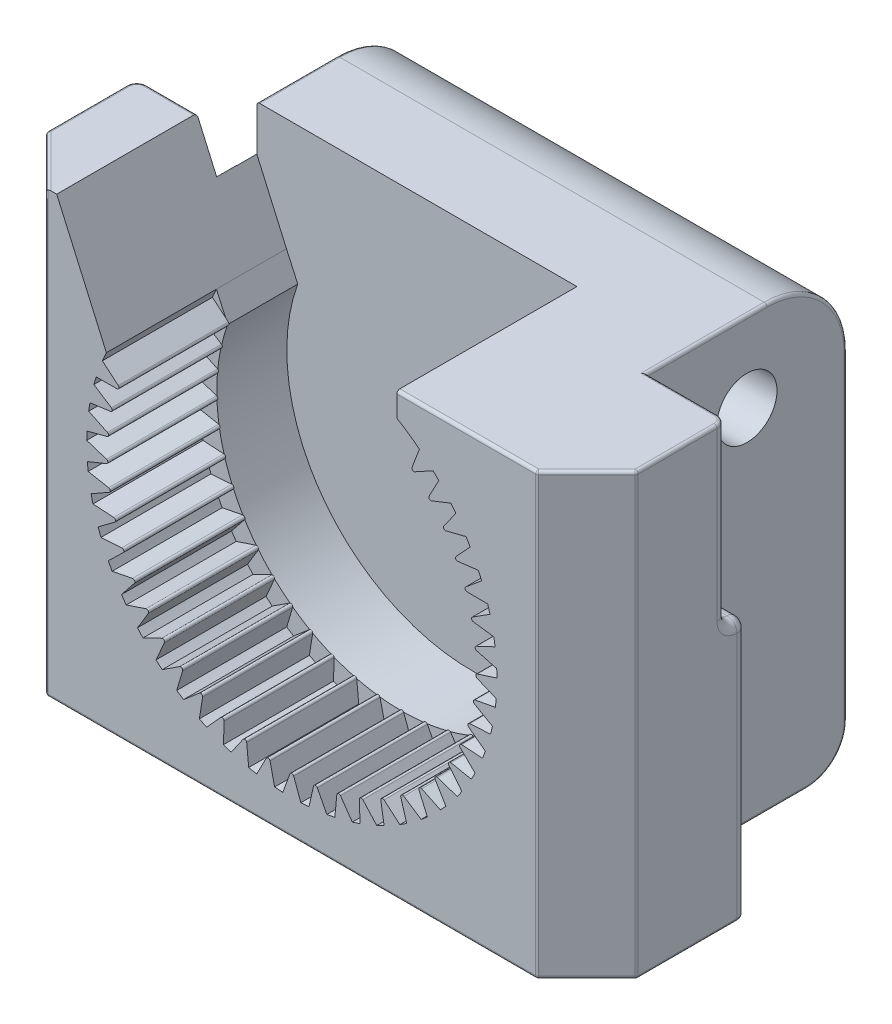
from build123d import *

# Parameters (mm, degrees)
SKETCH_1_W               = 59
SKETCH_1_H               = 44
EXTRUDE_1_DEPTH          = 34
SKETCH_2_R               = 4
CUT_EXTRUDE_1_DEPTH      = 51.102395152
CUT_EXTRUDE_2_DEPTH      = 63.946405775
CUT_EXTRUDE_3_DEPTH      = 18
CHAMFER_1_SIZE           = 5
CHAMFER_2_SIZE           = 5
FILLET_1_R               = 4
FILLET_2_R               = 8
SKETCH_6_R               = 3
CUT_EXTRUDE_4_DEPTH      = 66.122960621
CUT_EXTRUDE_5_DEPTH      = 2
FILLET_START             = -30
FILLET_3_DEPTH           = 8.5
FILLET_START_2           = 21.5
FILLET_3_2_DEPTH         = 8.5
FILLET_START_3           = -29.5
FILLET_3_3_DEPTH         = 8
FILLET_3_4_DEPTH         = 8
FILLET_4_R               = 1
FILLET_5_R               = 0.3
FILLET_6_R               = 0.3
EXTRUDE_START            = 7
EXTRUDE_2_DEPTH          = 7
EXTRUDE_3_DEPTH          = 11
PATTERN_CIRCULAR_1_COUNT = 16
PATTERN_CIRCULAR_1_ANGLE = 110
PATTERN_CIRCULAR_2_COUNT = 20
PATTERN_CIRCULAR_2_ANGLE = 139


with BuildPart() as part:
    # Эскиз1 → Бобышка-Вытянуть1 (new body)
    with BuildSketch(Plane.XY):
        Rectangle(SKETCH_1_W, SKETCH_1_H)
    extrude(amount=EXTRUDE_1_DEPTH)

    # Эскиз2 → Вырез-Вытянуть1 (cut, through all)
    with BuildSketch(Plane.XY.offset(34)):
        with Locations((0, 2)):
            Circle(SKETCH_2_R)
    extrude(amount=-CUT_EXTRUDE_1_DEPTH, mode=Mode.SUBTRACT)

    # Эскиз3 → Вырез-Вытянуть2 (cut, through all)
    with BuildSketch(Plane(origin=(0, 22, 0), x_dir=(1, 0, 0), z_dir=(0, 1, 0))):
        Polygon((-21.5, 5.182820552), (-21.5, -18), (-29.840908982, -18), (-29.840908982, 8.49465206), (29.840908982, 8.49465206), (29.840908982, -18), (21.5, -18), (21.5, 5.182820552), align=None)
    extrude(amount=-CUT_EXTRUDE_2_DEPTH, mode=Mode.SUBTRACT)

    # Эскиз4 → Вырез-Вытянуть3 (cut)
    with BuildSketch(Plane.XY.offset(34)):
        with BuildLine():
            Line((-23.5, 22), (-18.535280006, 10.757476525))
            ThreePointArc((-18.535280006, 10.757476525), (5.976548945, -17.609458501), (10.5, 19.606816862))
            Line((10.5, 19.606816862), (10.5, 22))
            Line((10.5, 22), (-23.5, 22))
        make_face()
    extrude(amount=-CUT_EXTRUDE_3_DEPTH, mode=Mode.SUBTRACT)

    # Фаска1
    chamfer_1_edges = [part.edges().sort_by_distance(p)[0] for p in [
        (-29.5, 0, 34),
    ]]
    chamfer(chamfer_1_edges, length=CHAMFER_1_SIZE)

    # Фаска2
    chamfer_2_edges = [part.edges().sort_by_distance(p)[0] for p in [
        (29.5, 0, 34),
    ]]
    chamfer(chamfer_2_edges, length=CHAMFER_2_SIZE)

    # Скругление1
    fillet_1_edges = [part.edges().sort_by_distance(p)[0] for p in [
        (0, -22, 0),
    ]]
    fillet(fillet_1_edges, radius=FILLET_1_R)

    # Скругление2
    fillet_2_edges = [part.edges().sort_by_distance(p)[0] for p in [
        (0, 22, 0),
    ]]
    fillet(fillet_2_edges, radius=FILLET_2_R)

    # Эскиз6 → Вырез-Вытянуть4 (cut, through all)
    with BuildSketch(Plane.ZY.offset(21.5)):
        with Locations((10, 14)):
            Circle(SKETCH_6_R)
    extrude(amount=-CUT_EXTRUDE_4_DEPTH, mode=Mode.SUBTRACT)

    # Эскиз7 → Вырез-Вытянуть5 (cut)
    with BuildSketch(Plane(origin=(0, 0, 18), x_dir=(-1, 0, 0), z_dir=(0, 0, -1))):
        Polygon((-29.5, 4), (-21.5, 4), (-21.5, 24.855557452), (21.514282903, 24.855557452), (21.5, 4), (29.5, 4), (29.5, 28.131804125), (-29.5, 28.131804125), align=None)
    extrude(amount=-CUT_EXTRUDE_5_DEPTH, mode=Mode.SUBTRACT)

    # Скругление3: read off the stored shape, not the designer's step
    # Скругление3 outline → Скругление3 (cut)
    with BuildSketch(Plane.YZ.offset(FILLET_START)):
        with BuildLine():
            Line((4, 18), (4, 19))
            ThreePointArc((4, 19), (3.707106781, 18.292893219), (3, 18))
            Line((3, 18), (4, 18))
        make_face()
    extrude(amount=FILLET_3_DEPTH, mode=Mode.SUBTRACT)

    # Fillet 3 2 outline → Fillet 3 2 (cut)
    with BuildSketch(Plane.YZ.offset(FILLET_START_2)):
        with BuildLine():
            Line((4, 18), (4, 19))
            ThreePointArc((4, 19), (3.707106781, 18.292893219), (3, 18))
            Line((3, 18), (4, 18))
        make_face()
    extrude(amount=FILLET_3_2_DEPTH, mode=Mode.SUBTRACT)

    # Fillet 3 3 outline → Fillet 3 3 (add)
    with BuildSketch(Plane.YZ.offset(FILLET_START_3)):
        with BuildLine():
            Line((4, 20), (4, 19))
            ThreePointArc((4, 19), (4.292893219, 19.707106781), (5, 20))
            Line((5, 20), (4, 20))
        make_face()
    extrude(amount=FILLET_3_3_DEPTH)

    # Fillet 3 4 outline → Fillet 3 4 (add)
    with BuildSketch(Plane.YZ.offset(FILLET_START_2)):
        with BuildLine():
            Line((4, 20), (4, 19))
            ThreePointArc((4, 19), (4.292893219, 19.707106781), (5, 20))
            Line((5, 20), (4, 20))
        make_face()
    extrude(amount=FILLET_3_4_DEPTH)

    # Скругление4
    fillet_4_edges = [part.edges().sort_by_distance(p)[0] for p in [
        (29.5, 13.5, 20),
        (-29.5, 13.5, 20),
        (-29.5, -9.5, 18),
        (-29.5, 3.707106781, 18.292893219),
        (29.5, 3.707106781, 18.292893219),
        (-29.5, 4.292893219, 19.707106781),
        (29.5, 4.292893219, 19.707106781),
        (29.5, -9.5, 18),
    ]]
    fillet(fillet_4_edges, radius=FILLET_4_R)

    # Скругление5
    fillet_5_edges = [part.edges().sort_by_distance(p)[0] for p in [
        (21.5, -22, 11),
        (21.5, -2, 0),
        (21.5, -20.828427125, 1.171572875),
        (-21.5, -20.828427125, 1.171572875),
        (21.5, 22, 14),
        (-21.5, -2, 0),
        (-21.5, 19.656854249, 2.343145751),
        (21.5, 19.656854249, 2.343145751),
        (-21.5, -22, 11),
        (-21.5, 22, 12),
    ]]
    fillet(fillet_5_edges, radius=FILLET_5_R)

    # Скругление6
    fillet_6_edges = [part.edges().sort_by_distance(p)[0] for p in [
        (-26, 22, 20),
        (-29.207106781, 22, 20.292893219),
        (24.85, 22, 20),
        (29.207106781, 22, 20.292893219),
        (-24.85, -22, 18),
        (-29.207106781, -22, 18.292893219),
        (24.85, -22, 18),
        (29.207106781, -22, 18.292893219),
        (-29.5, 0, 29),
        (-29.5, 22, 25),
        (-27, 22, 31.5),
        (-24.5, 0, 34),
        (29.5, 22, 25),
        (27, 22, 31.5),
        (17.5, 22, 34),
        (29.5, 0, 29),
        (24.5, 0, 34),
        (-29.5, -22, 24),
        (-27, -22, 31.5),
        (29.5, -22, 24),
        (27, -22, 31.5),
        (0, -22, 34),
    ]]
    fillet(fillet_6_edges, radius=FILLET_6_R)

    # Эскиз8 → Бобышка-Вытянуть2 (add)
    with BuildSketch(Plane.XY.offset(16).offset(EXTRUDE_START)):
        with BuildLine():
            Line((-18.535280006, 10.757476525), (-17.407140213, 8.264301206))
            ThreePointArc((-17.407140213, 8.264301206), (5.659506801, -15.613062845), (10.5, 17.231546212))
            Line((10.5, 17.231546212), (10.5, 19.606816862))
            ThreePointArc((10.5, 19.606816862), (5.976548945, -17.609458501), (-18.535280006, 10.757476525))
        make_face()
    extrude(amount=-EXTRUDE_2_DEPTH)

    # Эскиз10 → Бобышка-Вытянуть3 (add)
    with BuildSketch(Plane.XY.offset(23)):
        with BuildLine():
            Line((-0.187775263, -16.530367751), (-1.1, -19.018253397))
            Line((-1.1, -19.018253397), (1.1, -19.018253397))
            Line((1.1, -19.018253397), (0.187775263, -16.530367751))
            ThreePointArc((0.187775263, -16.530367751), (0, -16.399218681), (-0.187775263, -16.530367751))
        make_face()
    extrude_3 = extrude(amount=EXTRUDE_3_DEPTH)

    # Круговой массив1: Бобышка-Вытянуть3 ×16 about axis
    pattern_circular_1_axis = Axis((0, 2, 0), (0, 0, -1))
    for i in range(1, PATTERN_CIRCULAR_1_COUNT):
        add(extrude_3.rotate(pattern_circular_1_axis, i * PATTERN_CIRCULAR_1_ANGLE / (PATTERN_CIRCULAR_1_COUNT - 1)))

    # Круговой массив2: Бобышка-Вытянуть3 ×20 about axis
    pattern_circular_2_axis = Axis((0, 2, 0), (0, 0, 1))
    for i in range(1, PATTERN_CIRCULAR_2_COUNT):
        add(extrude_3.rotate(pattern_circular_2_axis, i * PATTERN_CIRCULAR_2_ANGLE / (PATTERN_CIRCULAR_2_COUNT - 1)))


solid = part.part
